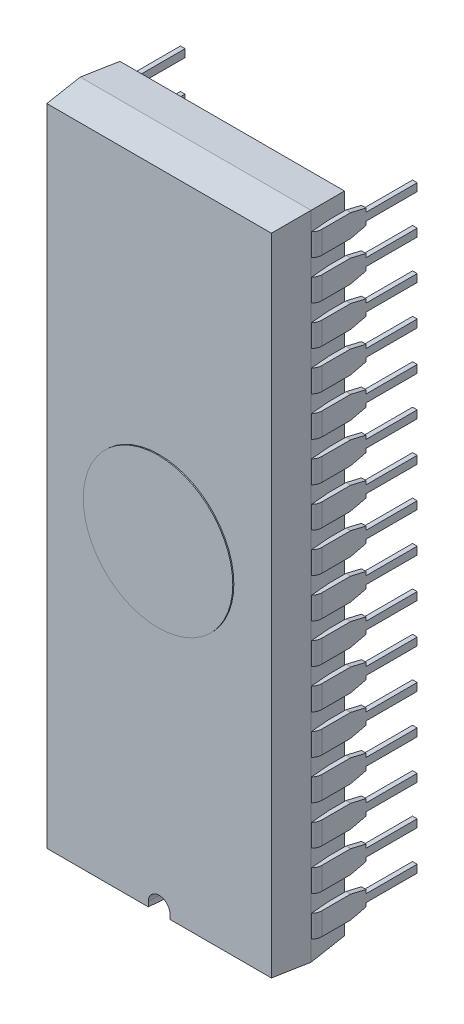
from build123d import *

# Parameters (mm, degrees)
BASIC_SHAPE_DEPTH               = 21.02
SIDE_PROFILE1_DEPTH             = 24.023060179
SIDE_PROFILE1_DEPTH_BACK        = 24.023060179
SIDE_PROFILE2_DEPTH             = 24.023060179
SIDE_PROFILE2_DEPTH_BACK        = 24.023060179
SKETCH6_W                       = 0.3
SKETCH6_H                       = 1.45
PIN_RELIEF_DEPTH                = 27.332330869
REMAINING_PINS_COUNT            = 16
REMAINING_PINS_PITCH            = 2.54
REMAINING_PINS_COPY_1_SKETCH_W  = 0.3
REMAINING_PINS_COPY_1_SKETCH_H  = 1.45
REMAINING_PINS_COPY_2_SKETCH_W  = 0.3
REMAINING_PINS_COPY_2_SKETCH_H  = 1.45
REMAINING_PINS_COPY_3_SKETCH_W  = 0.3
REMAINING_PINS_COPY_3_SKETCH_H  = 1.45
REMAINING_PINS_COPY_4_SKETCH_W  = 0.3
REMAINING_PINS_COPY_4_SKETCH_H  = 1.45
REMAINING_PINS_COPY_5_SKETCH_W  = 0.3
REMAINING_PINS_COPY_5_SKETCH_H  = 1.45
REMAINING_PINS_COPY_6_SKETCH_W  = 0.3
REMAINING_PINS_COPY_6_SKETCH_H  = 1.45
REMAINING_PINS_COPY_7_SKETCH_W  = 0.3
REMAINING_PINS_COPY_7_SKETCH_H  = 1.45
REMAINING_PINS_COPY_8_SKETCH_W  = 0.3
REMAINING_PINS_COPY_8_SKETCH_H  = 1.45
REMAINING_PINS_COPY_9_SKETCH_W  = 0.3
REMAINING_PINS_COPY_9_SKETCH_H  = 1.45
REMAINING_PINS_COPY_10_SKETCH_W = 0.3
REMAINING_PINS_COPY_10_SKETCH_H = 1.45
REMAINING_PINS_COPY_11_SKETCH_W = 0.3
REMAINING_PINS_COPY_11_SKETCH_H = 1.45
REMAINING_PINS_COPY_12_SKETCH_W = 0.3
REMAINING_PINS_COPY_12_SKETCH_H = 1.45
REMAINING_PINS_COPY_13_SKETCH_W = 0.3
REMAINING_PINS_COPY_13_SKETCH_H = 1.45
REMAINING_PINS_COPY_14_SKETCH_W = 0.3
REMAINING_PINS_COPY_14_SKETCH_H = 1.45
REMAINING_PINS_COPY_15_SKETCH_W = 0.3
REMAINING_PINS_COPY_15_SKETCH_H = 1.45
REMAINING_PINS_COPY_16_DEPTH    = 27.332330869
REMAINING_PINS_COPY_17_DEPTH    = 27.332330869
REMAINING_PINS_COPY_18_DEPTH    = 27.332330869
REMAINING_PINS_COPY_19_DEPTH    = 27.332330869
REMAINING_PINS_COPY_20_DEPTH    = 27.332330869
REMAINING_PINS_COPY_21_DEPTH    = 27.332330869
REMAINING_PINS_COPY_22_DEPTH    = 27.332330869
REMAINING_PINS_COPY_23_DEPTH    = 27.332330869
REMAINING_PINS_COPY_24_DEPTH    = 27.332330869
REMAINING_PINS_COPY_25_DEPTH    = 27.332330869
REMAINING_PINS_COPY_26_DEPTH    = 27.332330869
REMAINING_PINS_COPY_27_DEPTH    = 27.332330869
REMAINING_PINS_COPY_28_DEPTH    = 27.332330869
REMAINING_PINS_COPY_29_DEPTH    = 27.332330869
REMAINING_PINS_COPY_30_DEPTH    = 27.332330869
WINDOW_START                    = 5.72
WINDOW_OUTLINE_R                = 4.826
WINDOW_DEPTH                    = 0.07
LOCATION_MARK_DEPTH             = 25.116721357


# Read off the part's stored shape, not the designer's step: Window
with BuildPart() as part:
    # Sketch1 → Basic Shape (new, symmetric)
    with BuildSketch(Plane(origin=(0, 0, 0), x_dir=(1, 0, 0), z_dir=(0, 1, 0))):
        Polygon((-7.25, -5.72), (-7.45, -3.36), (-7.25, -1), (7.25, -1), (7.45, -3.36), (7.25, -5.72), align=None)
    extrude(amount=BASIC_SHAPE_DEPTH, both=True)

    # Sketch2 → Side Profile1 (cut, two sides: drawn at the far end of the back side and taken through both)
    with BuildSketch(Plane(origin=(0, 0, 0), x_dir=(0, 0, -1), z_dir=(1, 0, 0)).offset(-SIDE_PROFILE1_DEPTH_BACK)):
        Polygon((-1, 21.02), (-1, 20.82), (-3.36, 21.02), align=None)
        Polygon((-1, -21.02), (-3.36, -21.02), (-1, -20.82), align=None)
    extrude(amount=SIDE_PROFILE1_DEPTH + SIDE_PROFILE1_DEPTH_BACK, mode=Mode.SUBTRACT)

    # Sketch3 → Side Profile2 (cut, two sides: drawn at the far end of the back side and taken through both)
    with BuildSketch(Plane(origin=(0, 0, 0), x_dir=(0, 0, -1), z_dir=(1, 0, 0)).offset(-SIDE_PROFILE2_DEPTH_BACK)):
        Polygon((-3.36, 21.02), (-5.72, 21.02), (-5.72, 20.82), align=None)
        Polygon((-3.36, -21.02), (-5.72, -21.02), (-5.72, -20.82), align=None)
    extrude(amount=SIDE_PROFILE2_DEPTH + SIDE_PROFILE2_DEPTH_BACK, mode=Mode.SUBTRACT)

    # First Pin: sweep along a path in Sketch5
    with BuildLine(Plane(origin=(0, -19.02, 0), x_dir=(1, 0, 0), z_dir=(0, 1, 0))) as first_pin_path:
        Line((0, -3.36), (6.993, -3.36))
        ThreePointArc((6.993, -3.36), (7.346553391, -3.213553391), (7.493, -2.86))
        Line((7.493, -2.86), (7.493, 3.3))
    # Sketch6 → First Pin (sweep)
    with BuildSketch(Plane(origin=(0, 0, 0), x_dir=(0, 0, -1), z_dir=(1, 0, 0))):
        with Locations((-3.36, -19.02)):
            Rectangle(SKETCH6_W, SKETCH6_H)
    first_pin = sweep(path=first_pin_path.line)

    # Sketch7 → Pin Relief (cut, through all)
    with BuildSketch(Plane.ZY.offset(-7.343)):
        Polygon((-3.3, -19.27), (0, -19.27), (0, -19.5075), (1, -19.745), (-3.3, -19.745), align=None)
        Polygon((-3.3, -18.77), (0, -18.77), (0, -18.5325), (1, -18.295), (-3.3, -18.295), align=None)
    pin_relief = extrude(amount=-PIN_RELIEF_DEPTH, mode=Mode.SUBTRACT)

    # Opp Pin: First Pin, Pin Relief across plane
    add(first_pin.mirror(Plane(origin=(0, 0, 0), x_dir=(0, 0, 1), z_dir=(1, 0, 0))))
    add(pin_relief.mirror(Plane(origin=(0, 0, 0), x_dir=(0, 0, 1), z_dir=(1, 0, 0))), mode=Mode.SUBTRACT)

    # Remaining Pins: First Pin, Pin Relief ×16
    with Locations(*[(0, i * REMAINING_PINS_PITCH, 0) for i in range(1, REMAINING_PINS_COUNT)]):
        add(first_pin)
        add(pin_relief, mode=Mode.SUBTRACT)

    # Remaining Pins copy 1: sweep along a path in Remaining Pins copy 1 path
    with BuildLine(Plane(origin=(0, -16.48, 0), x_dir=(-1, 0, 0), z_dir=(0, 1, 0))) as remaining_pins_copy_1_path:
        Line((0, 3.36), (6.993, 3.36))
        ThreePointArc((6.993, 3.36), (7.346553391, 3.213553391), (7.493, 2.86))
        Line((7.493, 2.86), (7.493, -3.3))
    # Remaining Pins copy 1 sketch → Remaining Pins copy 1 (sweep)
    with BuildSketch(Plane(origin=(0, 2.54, 0), x_dir=(0, 0, -1), z_dir=(-1, 0, 0))):
        with Locations((-3.36, 19.02)):
            Rectangle(REMAINING_PINS_COPY_1_SKETCH_W, REMAINING_PINS_COPY_1_SKETCH_H)
    sweep(path=remaining_pins_copy_1_path.line)

    # Remaining Pins copy 2: sweep along a path in Remaining Pins copy 2 path
    with BuildLine(Plane(origin=(0, -13.94, 0), x_dir=(-1, 0, 0), z_dir=(0, 1, 0))) as remaining_pins_copy_2_path:
        Line((0, 3.36), (6.993, 3.36))
        ThreePointArc((6.993, 3.36), (7.346553391, 3.213553391), (7.493, 2.86))
        Line((7.493, 2.86), (7.493, -3.3))
    # Remaining Pins copy 2 sketch → Remaining Pins copy 2 (sweep)
    with BuildSketch(Plane(origin=(0, 5.08, 0), x_dir=(0, 0, -1), z_dir=(-1, 0, 0))):
        with Locations((-3.36, 19.02)):
            Rectangle(REMAINING_PINS_COPY_2_SKETCH_W, REMAINING_PINS_COPY_2_SKETCH_H)
    sweep(path=remaining_pins_copy_2_path.line)

    # Remaining Pins copy 3: sweep along a path in Remaining Pins copy 3 path
    with BuildLine(Plane(origin=(0, -11.4, 0), x_dir=(-1, 0, 0), z_dir=(0, 1, 0))) as remaining_pins_copy_3_path:
        Line((0, 3.36), (6.993, 3.36))
        ThreePointArc((6.993, 3.36), (7.346553391, 3.213553391), (7.493, 2.86))
        Line((7.493, 2.86), (7.493, -3.3))
    # Remaining Pins copy 3 sketch → Remaining Pins copy 3 (sweep)
    with BuildSketch(Plane(origin=(0, 7.62, 0), x_dir=(0, 0, -1), z_dir=(-1, 0, 0))):
        with Locations((-3.36, 19.02)):
            Rectangle(REMAINING_PINS_COPY_3_SKETCH_W, REMAINING_PINS_COPY_3_SKETCH_H)
    sweep(path=remaining_pins_copy_3_path.line)

    # Remaining Pins copy 4: sweep along a path in Remaining Pins copy 4 path
    with BuildLine(Plane(origin=(0, -8.86, 0), x_dir=(-1, 0, 0), z_dir=(0, 1, 0))) as remaining_pins_copy_4_path:
        Line((0, 3.36), (6.993, 3.36))
        ThreePointArc((6.993, 3.36), (7.346553391, 3.213553391), (7.493, 2.86))
        Line((7.493, 2.86), (7.493, -3.3))
    # Remaining Pins copy 4 sketch → Remaining Pins copy 4 (sweep)
    with BuildSketch(Plane(origin=(0, 10.16, 0), x_dir=(0, 0, -1), z_dir=(-1, 0, 0))):
        with Locations((-3.36, 19.02)):
            Rectangle(REMAINING_PINS_COPY_4_SKETCH_W, REMAINING_PINS_COPY_4_SKETCH_H)
    sweep(path=remaining_pins_copy_4_path.line)

    # Remaining Pins copy 5: sweep along a path in Remaining Pins copy 5 path
    with BuildLine(Plane(origin=(0, -6.32, 0), x_dir=(-1, 0, 0), z_dir=(0, 1, 0))) as remaining_pins_copy_5_path:
        Line((0, 3.36), (6.993, 3.36))
        ThreePointArc((6.993, 3.36), (7.346553391, 3.213553391), (7.493, 2.86))
        Line((7.493, 2.86), (7.493, -3.3))
    # Remaining Pins copy 5 sketch → Remaining Pins copy 5 (sweep)
    with BuildSketch(Plane(origin=(0, 12.7, 0), x_dir=(0, 0, -1), z_dir=(-1, 0, 0))):
        with Locations((-3.36, 19.02)):
            Rectangle(REMAINING_PINS_COPY_5_SKETCH_W, REMAINING_PINS_COPY_5_SKETCH_H)
    sweep(path=remaining_pins_copy_5_path.line)

    # Remaining Pins copy 6: sweep along a path in Remaining Pins copy 6 path
    with BuildLine(Plane(origin=(0, -3.78, 0), x_dir=(-1, 0, 0), z_dir=(0, 1, 0))) as remaining_pins_copy_6_path:
        Line((0, 3.36), (6.993, 3.36))
        ThreePointArc((6.993, 3.36), (7.346553391, 3.213553391), (7.493, 2.86))
        Line((7.493, 2.86), (7.493, -3.3))
    # Remaining Pins copy 6 sketch → Remaining Pins copy 6 (sweep)
    with BuildSketch(Plane(origin=(0, 15.24, 0), x_dir=(0, 0, -1), z_dir=(-1, 0, 0))):
        with Locations((-3.36, 19.02)):
            Rectangle(REMAINING_PINS_COPY_6_SKETCH_W, REMAINING_PINS_COPY_6_SKETCH_H)
    sweep(path=remaining_pins_copy_6_path.line)

    # Remaining Pins copy 7: sweep along a path in Remaining Pins copy 7 path
    with BuildLine(Plane(origin=(0, -1.24, 0), x_dir=(-1, 0, 0), z_dir=(0, 1, 0))) as remaining_pins_copy_7_path:
        Line((0, 3.36), (6.993, 3.36))
        ThreePointArc((6.993, 3.36), (7.346553391, 3.213553391), (7.493, 2.86))
        Line((7.493, 2.86), (7.493, -3.3))
    # Remaining Pins copy 7 sketch → Remaining Pins copy 7 (sweep)
    with BuildSketch(Plane(origin=(0, 17.78, 0), x_dir=(0, 0, -1), z_dir=(-1, 0, 0))):
        with Locations((-3.36, 19.02)):
            Rectangle(REMAINING_PINS_COPY_7_SKETCH_W, REMAINING_PINS_COPY_7_SKETCH_H)
    sweep(path=remaining_pins_copy_7_path.line)

    # Remaining Pins copy 8: sweep along a path in Remaining Pins copy 8 path
    with BuildLine(Plane(origin=(0, 1.3, 0), x_dir=(-1, 0, 0), z_dir=(0, 1, 0))) as remaining_pins_copy_8_path:
        Line((0, 3.36), (6.993, 3.36))
        ThreePointArc((6.993, 3.36), (7.346553391, 3.213553391), (7.493, 2.86))
        Line((7.493, 2.86), (7.493, -3.3))
    # Remaining Pins copy 8 sketch → Remaining Pins copy 8 (sweep)
    with BuildSketch(Plane(origin=(0, 20.32, 0), x_dir=(0, 0, -1), z_dir=(-1, 0, 0))):
        with Locations((-3.36, 19.02)):
            Rectangle(REMAINING_PINS_COPY_8_SKETCH_W, REMAINING_PINS_COPY_8_SKETCH_H)
    sweep(path=remaining_pins_copy_8_path.line)

    # Remaining Pins copy 9: sweep along a path in Remaining Pins copy 9 path
    with BuildLine(Plane(origin=(0, 3.84, 0), x_dir=(-1, 0, 0), z_dir=(0, 1, 0))) as remaining_pins_copy_9_path:
        Line((0, 3.36), (6.993, 3.36))
        ThreePointArc((6.993, 3.36), (7.346553391, 3.213553391), (7.493, 2.86))
        Line((7.493, 2.86), (7.493, -3.3))
    # Remaining Pins copy 9 sketch → Remaining Pins copy 9 (sweep)
    with BuildSketch(Plane(origin=(0, 22.86, 0), x_dir=(0, 0, -1), z_dir=(-1, 0, 0))):
        with Locations((-3.36, 19.02)):
            Rectangle(REMAINING_PINS_COPY_9_SKETCH_W, REMAINING_PINS_COPY_9_SKETCH_H)
    sweep(path=remaining_pins_copy_9_path.line)

    # Remaining Pins copy 10: sweep along a path in Remaining Pins copy 10 path
    with BuildLine(Plane(origin=(0, 6.38, 0), x_dir=(-1, 0, 0), z_dir=(0, 1, 0))) as remaining_pins_copy_10_path:
        Line((0, 3.36), (6.993, 3.36))
        ThreePointArc((6.993, 3.36), (7.346553391, 3.213553391), (7.493, 2.86))
        Line((7.493, 2.86), (7.493, -3.3))
    # Remaining Pins copy 10 sketch → Remaining Pins copy 10 (sweep)
    with BuildSketch(Plane(origin=(0, 25.4, 0), x_dir=(0, 0, -1), z_dir=(-1, 0, 0))):
        with Locations((-3.36, 19.02)):
            Rectangle(REMAINING_PINS_COPY_10_SKETCH_W, REMAINING_PINS_COPY_10_SKETCH_H)
    sweep(path=remaining_pins_copy_10_path.line)

    # Remaining Pins copy 11: sweep along a path in Remaining Pins copy 11 path
    with BuildLine(Plane(origin=(0, 8.92, 0), x_dir=(-1, 0, 0), z_dir=(0, 1, 0))) as remaining_pins_copy_11_path:
        Line((0, 3.36), (6.993, 3.36))
        ThreePointArc((6.993, 3.36), (7.346553391, 3.213553391), (7.493, 2.86))
        Line((7.493, 2.86), (7.493, -3.3))
    # Remaining Pins copy 11 sketch → Remaining Pins copy 11 (sweep)
    with BuildSketch(Plane(origin=(0, 27.94, 0), x_dir=(0, 0, -1), z_dir=(-1, 0, 0))):
        with Locations((-3.36, 19.02)):
            Rectangle(REMAINING_PINS_COPY_11_SKETCH_W, REMAINING_PINS_COPY_11_SKETCH_H)
    sweep(path=remaining_pins_copy_11_path.line)

    # Remaining Pins copy 12: sweep along a path in Remaining Pins copy 12 path
    with BuildLine(Plane(origin=(0, 11.46, 0), x_dir=(-1, 0, 0), z_dir=(0, 1, 0))) as remaining_pins_copy_12_path:
        Line((0, 3.36), (6.993, 3.36))
        ThreePointArc((6.993, 3.36), (7.346553391, 3.213553391), (7.493, 2.86))
        Line((7.493, 2.86), (7.493, -3.3))
    # Remaining Pins copy 12 sketch → Remaining Pins copy 12 (sweep)
    with BuildSketch(Plane(origin=(0, 30.48, 0), x_dir=(0, 0, -1), z_dir=(-1, 0, 0))):
        with Locations((-3.36, 19.02)):
            Rectangle(REMAINING_PINS_COPY_12_SKETCH_W, REMAINING_PINS_COPY_12_SKETCH_H)
    sweep(path=remaining_pins_copy_12_path.line)

    # Remaining Pins copy 13: sweep along a path in Remaining Pins copy 13 path
    with BuildLine(Plane(origin=(0, 14, 0), x_dir=(-1, 0, 0), z_dir=(0, 1, 0))) as remaining_pins_copy_13_path:
        Line((0, 3.36), (6.993, 3.36))
        ThreePointArc((6.993, 3.36), (7.346553391, 3.213553391), (7.493, 2.86))
        Line((7.493, 2.86), (7.493, -3.3))
    # Remaining Pins copy 13 sketch → Remaining Pins copy 13 (sweep)
    with BuildSketch(Plane(origin=(0, 33.02, 0), x_dir=(0, 0, -1), z_dir=(-1, 0, 0))):
        with Locations((-3.36, 19.02)):
            Rectangle(REMAINING_PINS_COPY_13_SKETCH_W, REMAINING_PINS_COPY_13_SKETCH_H)
    sweep(path=remaining_pins_copy_13_path.line)

    # Remaining Pins copy 14: sweep along a path in Remaining Pins copy 14 path
    with BuildLine(Plane(origin=(0, 16.54, 0), x_dir=(-1, 0, 0), z_dir=(0, 1, 0))) as remaining_pins_copy_14_path:
        Line((0, 3.36), (6.993, 3.36))
        ThreePointArc((6.993, 3.36), (7.346553391, 3.213553391), (7.493, 2.86))
        Line((7.493, 2.86), (7.493, -3.3))
    # Remaining Pins copy 14 sketch → Remaining Pins copy 14 (sweep)
    with BuildSketch(Plane(origin=(0, 35.56, 0), x_dir=(0, 0, -1), z_dir=(-1, 0, 0))):
        with Locations((-3.36, 19.02)):
            Rectangle(REMAINING_PINS_COPY_14_SKETCH_W, REMAINING_PINS_COPY_14_SKETCH_H)
    sweep(path=remaining_pins_copy_14_path.line)

    # Remaining Pins copy 15: sweep along a path in Remaining Pins copy 15 path
    with BuildLine(Plane(origin=(0, 19.08, 0), x_dir=(-1, 0, 0), z_dir=(0, 1, 0))) as remaining_pins_copy_15_path:
        Line((0, 3.36), (6.993, 3.36))
        ThreePointArc((6.993, 3.36), (7.346553391, 3.213553391), (7.493, 2.86))
        Line((7.493, 2.86), (7.493, -3.3))
    # Remaining Pins copy 15 sketch → Remaining Pins copy 15 (sweep)
    with BuildSketch(Plane(origin=(0, 38.1, 0), x_dir=(0, 0, -1), z_dir=(-1, 0, 0))):
        with Locations((-3.36, 19.02)):
            Rectangle(REMAINING_PINS_COPY_15_SKETCH_W, REMAINING_PINS_COPY_15_SKETCH_H)
    sweep(path=remaining_pins_copy_15_path.line)

    # Remaining Pins copy 16 sketch → Remaining Pins copy 16 (cut, through all)
    with BuildSketch(Plane(origin=(-7.343, 2.54, 0), x_dir=(0, 0, 1), z_dir=(1, 0, 0))):
        Polygon((-3.3, 19.27), (0, 19.27), (0, 19.5075), (1, 19.745), (-3.3, 19.745), align=None)
        Polygon((-3.3, 18.77), (0, 18.77), (0, 18.5325), (1, 18.295), (-3.3, 18.295), align=None)
    extrude(amount=-REMAINING_PINS_COPY_16_DEPTH, mode=Mode.SUBTRACT)

    # Remaining Pins copy 17 sketch → Remaining Pins copy 17 (cut, through all)
    with BuildSketch(Plane(origin=(-7.343, 5.08, 0), x_dir=(0, 0, 1), z_dir=(1, 0, 0))):
        Polygon((-3.3, 19.27), (0, 19.27), (0, 19.5075), (1, 19.745), (-3.3, 19.745), align=None)
        Polygon((-3.3, 18.77), (0, 18.77), (0, 18.5325), (1, 18.295), (-3.3, 18.295), align=None)
    extrude(amount=-REMAINING_PINS_COPY_17_DEPTH, mode=Mode.SUBTRACT)

    # Remaining Pins copy 18 sketch → Remaining Pins copy 18 (cut, through all)
    with BuildSketch(Plane(origin=(-7.343, 7.62, 0), x_dir=(0, 0, 1), z_dir=(1, 0, 0))):
        Polygon((-3.3, 19.27), (0, 19.27), (0, 19.5075), (1, 19.745), (-3.3, 19.745), align=None)
        Polygon((-3.3, 18.77), (0, 18.77), (0, 18.5325), (1, 18.295), (-3.3, 18.295), align=None)
    extrude(amount=-REMAINING_PINS_COPY_18_DEPTH, mode=Mode.SUBTRACT)

    # Remaining Pins copy 19 sketch → Remaining Pins copy 19 (cut, through all)
    with BuildSketch(Plane(origin=(-7.343, 10.16, 0), x_dir=(0, 0, 1), z_dir=(1, 0, 0))):
        Polygon((-3.3, 19.27), (0, 19.27), (0, 19.5075), (1, 19.745), (-3.3, 19.745), align=None)
        Polygon((-3.3, 18.77), (0, 18.77), (0, 18.5325), (1, 18.295), (-3.3, 18.295), align=None)
    extrude(amount=-REMAINING_PINS_COPY_19_DEPTH, mode=Mode.SUBTRACT)

    # Remaining Pins copy 20 sketch → Remaining Pins copy 20 (cut, through all)
    with BuildSketch(Plane(origin=(-7.343, 12.7, 0), x_dir=(0, 0, 1), z_dir=(1, 0, 0))):
        Polygon((-3.3, 19.27), (0, 19.27), (0, 19.5075), (1, 19.745), (-3.3, 19.745), align=None)
        Polygon((-3.3, 18.77), (0, 18.77), (0, 18.5325), (1, 18.295), (-3.3, 18.295), align=None)
    extrude(amount=-REMAINING_PINS_COPY_20_DEPTH, mode=Mode.SUBTRACT)

    # Remaining Pins copy 21 sketch → Remaining Pins copy 21 (cut, through all)
    with BuildSketch(Plane(origin=(-7.343, 15.24, 0), x_dir=(0, 0, 1), z_dir=(1, 0, 0))):
        Polygon((-3.3, 19.27), (0, 19.27), (0, 19.5075), (1, 19.745), (-3.3, 19.745), align=None)
        Polygon((-3.3, 18.77), (0, 18.77), (0, 18.5325), (1, 18.295), (-3.3, 18.295), align=None)
    extrude(amount=-REMAINING_PINS_COPY_21_DEPTH, mode=Mode.SUBTRACT)

    # Remaining Pins copy 22 sketch → Remaining Pins copy 22 (cut, through all)
    with BuildSketch(Plane(origin=(-7.343, 17.78, 0), x_dir=(0, 0, 1), z_dir=(1, 0, 0))):
        Polygon((-3.3, 19.27), (0, 19.27), (0, 19.5075), (1, 19.745), (-3.3, 19.745), align=None)
        Polygon((-3.3, 18.77), (0, 18.77), (0, 18.5325), (1, 18.295), (-3.3, 18.295), align=None)
    extrude(amount=-REMAINING_PINS_COPY_22_DEPTH, mode=Mode.SUBTRACT)

    # Remaining Pins copy 23 sketch → Remaining Pins copy 23 (cut, through all)
    with BuildSketch(Plane(origin=(-7.343, 20.32, 0), x_dir=(0, 0, 1), z_dir=(1, 0, 0))):
        Polygon((-3.3, 19.27), (0, 19.27), (0, 19.5075), (1, 19.745), (-3.3, 19.745), align=None)
        Polygon((-3.3, 18.77), (0, 18.77), (0, 18.5325), (1, 18.295), (-3.3, 18.295), align=None)
    extrude(amount=-REMAINING_PINS_COPY_23_DEPTH, mode=Mode.SUBTRACT)

    # Remaining Pins copy 24 sketch → Remaining Pins copy 24 (cut, through all)
    with BuildSketch(Plane(origin=(-7.343, 22.86, 0), x_dir=(0, 0, 1), z_dir=(1, 0, 0))):
        Polygon((-3.3, 19.27), (0, 19.27), (0, 19.5075), (1, 19.745), (-3.3, 19.745), align=None)
        Polygon((-3.3, 18.77), (0, 18.77), (0, 18.5325), (1, 18.295), (-3.3, 18.295), align=None)
    extrude(amount=-REMAINING_PINS_COPY_24_DEPTH, mode=Mode.SUBTRACT)

    # Remaining Pins copy 25 sketch → Remaining Pins copy 25 (cut, through all)
    with BuildSketch(Plane(origin=(-7.343, 25.4, 0), x_dir=(0, 0, 1), z_dir=(1, 0, 0))):
        Polygon((-3.3, 19.27), (0, 19.27), (0, 19.5075), (1, 19.745), (-3.3, 19.745), align=None)
        Polygon((-3.3, 18.77), (0, 18.77), (0, 18.5325), (1, 18.295), (-3.3, 18.295), align=None)
    extrude(amount=-REMAINING_PINS_COPY_25_DEPTH, mode=Mode.SUBTRACT)

    # Remaining Pins copy 26 sketch → Remaining Pins copy 26 (cut, through all)
    with BuildSketch(Plane(origin=(-7.343, 27.94, 0), x_dir=(0, 0, 1), z_dir=(1, 0, 0))):
        Polygon((-3.3, 19.27), (0, 19.27), (0, 19.5075), (1, 19.745), (-3.3, 19.745), align=None)
        Polygon((-3.3, 18.77), (0, 18.77), (0, 18.5325), (1, 18.295), (-3.3, 18.295), align=None)
    extrude(amount=-REMAINING_PINS_COPY_26_DEPTH, mode=Mode.SUBTRACT)

    # Remaining Pins copy 27 sketch → Remaining Pins copy 27 (cut, through all)
    with BuildSketch(Plane(origin=(-7.343, 30.48, 0), x_dir=(0, 0, 1), z_dir=(1, 0, 0))):
        Polygon((-3.3, 19.27), (0, 19.27), (0, 19.5075), (1, 19.745), (-3.3, 19.745), align=None)
        Polygon((-3.3, 18.77), (0, 18.77), (0, 18.5325), (1, 18.295), (-3.3, 18.295), align=None)
    extrude(amount=-REMAINING_PINS_COPY_27_DEPTH, mode=Mode.SUBTRACT)

    # Remaining Pins copy 28 sketch → Remaining Pins copy 28 (cut, through all)
    with BuildSketch(Plane(origin=(-7.343, 33.02, 0), x_dir=(0, 0, 1), z_dir=(1, 0, 0))):
        Polygon((-3.3, 19.27), (0, 19.27), (0, 19.5075), (1, 19.745), (-3.3, 19.745), align=None)
        Polygon((-3.3, 18.77), (0, 18.77), (0, 18.5325), (1, 18.295), (-3.3, 18.295), align=None)
    extrude(amount=-REMAINING_PINS_COPY_28_DEPTH, mode=Mode.SUBTRACT)

    # Remaining Pins copy 29 sketch → Remaining Pins copy 29 (cut, through all)
    with BuildSketch(Plane(origin=(-7.343, 35.56, 0), x_dir=(0, 0, 1), z_dir=(1, 0, 0))):
        Polygon((-3.3, 19.27), (0, 19.27), (0, 19.5075), (1, 19.745), (-3.3, 19.745), align=None)
        Polygon((-3.3, 18.77), (0, 18.77), (0, 18.5325), (1, 18.295), (-3.3, 18.295), align=None)
    extrude(amount=-REMAINING_PINS_COPY_29_DEPTH, mode=Mode.SUBTRACT)

    # Remaining Pins copy 30 sketch → Remaining Pins copy 30 (cut, through all)
    with BuildSketch(Plane(origin=(-7.343, 38.1, 0), x_dir=(0, 0, 1), z_dir=(1, 0, 0))):
        Polygon((-3.3, 19.27), (0, 19.27), (0, 19.5075), (1, 19.745), (-3.3, 19.745), align=None)
        Polygon((-3.3, 18.77), (0, 18.77), (0, 18.5325), (1, 18.295), (-3.3, 18.295), align=None)
    extrude(amount=-REMAINING_PINS_COPY_30_DEPTH, mode=Mode.SUBTRACT)

    # Window outline → Window (add)
    with BuildSketch(Plane.XY.offset(WINDOW_START)):
        Circle(WINDOW_OUTLINE_R)
    extrude(amount=WINDOW_DEPTH)

    # Sketch4 → Location Mark (cut, through all)
    with BuildSketch(Plane.XY.offset(5.72)):
        with BuildLine():
            Line((-0.7, -21.02), (-0.7, -20.52))
            ThreePointArc((-0.7, -20.52), (0, -19.82), (0.7, -20.52))
            Line((0.7, -20.52), (0.7, -21.02))
            Line((0.7, -21.02), (-0.7, -21.02))
        make_face()
    extrude(amount=-LOCATION_MARK_DEPTH, mode=Mode.SUBTRACT)


solid = part.part
